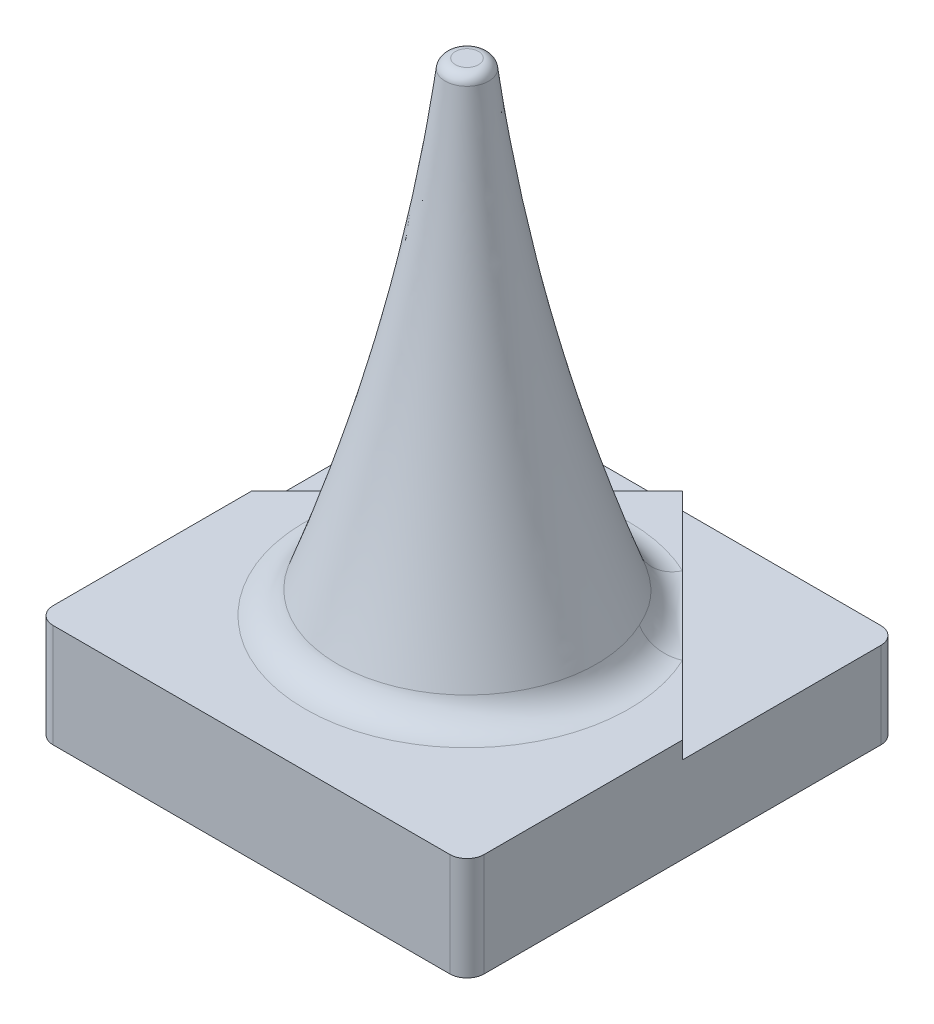
from build123d import *

# Parameters (mm, degrees)
ESQUISSE1_W             = 12.5
ESQUISSE1_H             = 12.5
BOSS_EXTRU_1_DEPTH      = 3
ENL_V_MAT_EXTRU_1_DEPTH = 0.5
CONG_2_R                = 0.3
CONG_3_R                = 0.5
CONG_4_R                = 1


with BuildPart() as part:
    # Esquisse1 → Boss.-Extru.1 (new body)
    with BuildSketch(Plane(origin=(0, 0, 0), x_dir=(1, 0, 0), z_dir=(0, 1, 0))):
        Rectangle(ESQUISSE1_W, ESQUISSE1_H)
    extrude(amount=BOSS_EXTRU_1_DEPTH)

    # Esquisse2 → Enlèv. mat.-Extru.1 (cut)
    with BuildSketch(Plane(origin=(0, 3, 0), x_dir=(1, 0, 0), z_dir=(0, 1, 0))):
        Polygon((-6.25, 6.25), (-6.25, 0), (0, 6.25), align=None)
        Polygon((6.25, 6.25), (0, 6.25), (6.25, 0), align=None)
    extrude(amount=-ENL_V_MAT_EXTRU_1_DEPTH, mode=Mode.SUBTRACT)

    # Esquisse4 → Révolution1 (revolve)
    with BuildSketch(Plane.XY):
        with BuildLine():
            Line((0, 17), (0, 3))
            Line((0, 3), (4, 3))
            add(Edge.make_bspline(
                [(4, 3), (1.455033525, 9.770356324), (0.6, 17)],
                knots=[0, 0, 0, 1, 1, 1], degree=2))
            Line((0.6, 17), (0, 17))
        make_face()
    revolve(axis=Axis((0, 17, 0), (0, -1, 0)))

    # Congé2
    cong_2_edges = [part.edges().sort_by_distance(p)[0] for p in [
        (-0.6, 17, 0),
    ]]
    fillet(cong_2_edges, radius=CONG_2_R)

    # Congé3
    cong_3_edges = [part.edges().sort_by_distance(p)[0] for p in [
        (-6.25, 1.25, -6.25),
        (6.25, 1.25, -6.25),
        (6.25, 1.5, 6.25),
        (-6.25, 1.5, 6.25),
    ]]
    fillet(cong_3_edges, radius=CONG_3_R)

    # Esquisse5 → Enlèvement de matière-Révolution1 (revolve, cut)
    with BuildSketch(Plane.XY):
        with BuildLine():
            Line((0, 16), (0, 0))
            Line((0, 0), (4.25, 0))
            add(Edge.make_bspline(
                [(4.25, 0), (2.407636052, 3.831055764), (0.830342052, 13.115127784), (0.47136659, 16)],
                knots=[0, 0, 0, 0, 1, 1, 1, 1], degree=3))
            Line((0.47136659, 16), (0, 16))
        make_face()
    revolve(axis=Axis((0, 16, 0), (0, -1, 0)), mode=Mode.SUBTRACT)

    # Congé4
    cong_4_edges = [part.edges().sort_by_distance(p)[0] for p in [
        (-4, 3, 0),
    ]]
    fillet(cong_4_edges, radius=CONG_4_R)


solid = part.part
